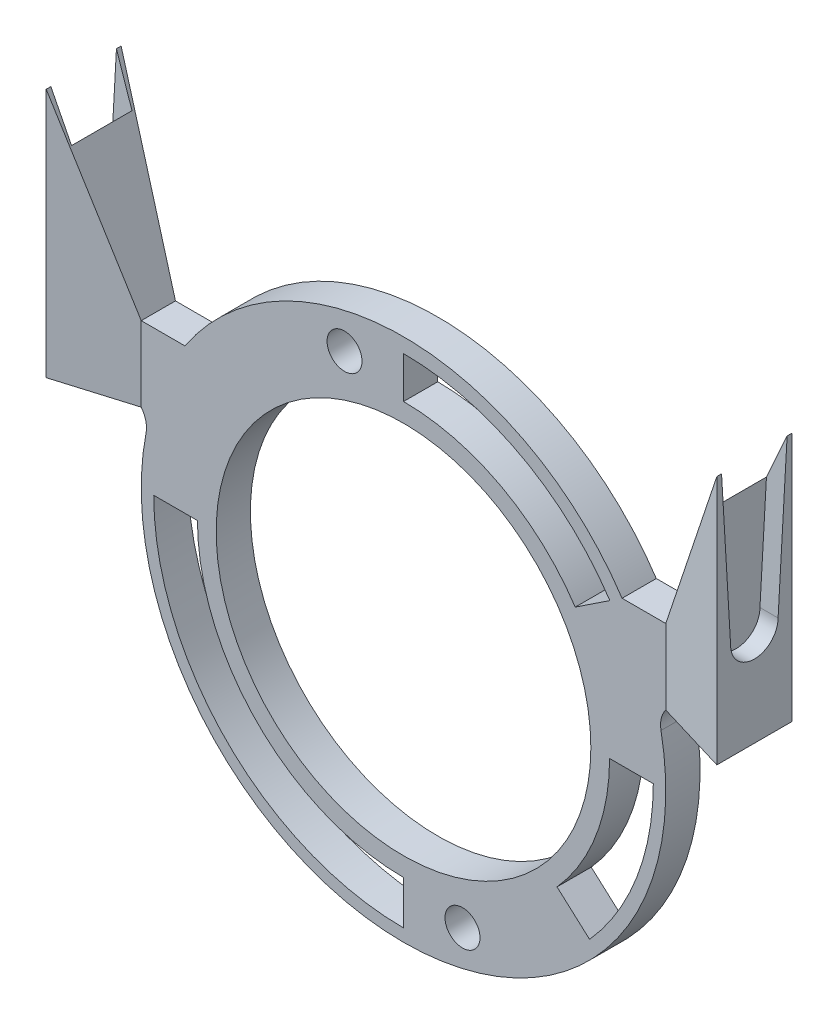
from build123d import *

# Parameters (mm, degrees)
SKETCH_1_R          = 15
SKETCH_1_R_2        = 1.4
EXTRUDE_1_DEPTH     = 2.74
SKETCH_3_W          = 2.74
SKETCH_3_H          = 6
EXTRUDE_3_DEPTH     = 3.5
SKETCH_11_W         = 2.74
SKETCH_11_H         = 6
EXTRUDE_8_DEPTH     = 3.5
FILLET_17_R         = 2
FILLET_19_R         = 2
CUT_EXTRUDE_1_DEPTH = 1.45
CUT_EXTRUDE_START   = -1.45
CUT_EXTRUDE_2_DEPTH = 1.45


with BuildPart() as part:
    # 草图1 → 凸台-拉伸1 (new body)
    with BuildSketch(Plane.XY):
        with BuildLine():
            Line((25.602982383, 9.901284161), (25.602982383, 3.901284161))
            Line((25.602982383, 3.901284161), (22.865684115, 3.901284161))
            ThreePointArc((22.865684115, 3.901284161), (43.102982383, -22.706902605), (63.340280651, 3.901284161))
            Line((63.340280651, 3.901284161), (60.602982383, 3.901284161))
            Line((60.602982383, 3.901284161), (60.602982383, 9.901284161))
            ThreePointArc((60.602982383, 9.901284161), (43.102982383, 19.293097395), (25.602982383, 9.901284161))
        make_face()
        with Locations((43.102982383, -1.706902605)):
            Circle(SKETCH_1_R, mode=Mode.SUBTRACT)
        with Locations((38.37953481, 15.921243725)):
            Circle(SKETCH_1_R_2, mode=Mode.SUBTRACT)
        with Locations((47.826429956, -19.335048935)):
            Circle(SKETCH_1_R_2, mode=Mode.SUBTRACT)
        with BuildLine():
            Line((26.602982383, -1.706902605), (23.102982383, -1.706902605))
            ThreePointArc((23.102982383, -1.706902605), (28.96084676, -15.849038229), (43.102982383, -21.706902605))
            Line((43.102982383, -21.706902605), (43.102982383, -18.206902605))
            ThreePointArc((43.102982383, -18.206902605), (31.435720494, -13.374164495), (26.602982383, -1.706902605))
        make_face(mode=Mode.SUBTRACT)
        with BuildLine():
            Line((43.102982383, 14.793097395), (43.102982383, 18.12026115))
            ThreePointArc((43.102982383, 18.12026115), (52.478832846, 15.763353566), (59.625618846, 9.252974534))
            Line((59.625618846, 9.252974534), (56.852982383, 7.413815568))
            ThreePointArc((56.852982383, 7.413815568), (50.905486793, 12.831698598), (43.102982383, 14.793097395))
        make_face(mode=Mode.SUBTRACT)
        with BuildLine():
            Line((55.393395475, -12.715796557), (58.000452797, -15.051016486))
            ThreePointArc((58.000452797, -15.051016486), (61.783847035, -8.850101879), (63.102982383, -1.706902605))
            Line((63.102982383, -1.706902605), (59.602982383, -1.706902605))
            ThreePointArc((59.602982383, -1.706902605), (58.514695721, -7.600042006), (55.393395475, -12.715796557))
        make_face(mode=Mode.SUBTRACT)
    extrude(amount=EXTRUDE_1_DEPTH)

    # 草图3 → 凸台-拉伸3 (add)
    with BuildSketch(Plane.ZY.offset(-25.602982383)):
        with Locations((1.37, 6.901284161)):
            Rectangle(SKETCH_3_W, SKETCH_3_H)
    extrude(amount=EXTRUDE_3_DEPTH)

    # 草图11 → 凸台-拉伸8 (add)
    with BuildSketch(Plane(origin=(60.602982383, 0, 0), x_dir=(0, 0, -1), z_dir=(1, 0, 0))):
        with Locations((-1.37, 6.901284161)):
            Rectangle(SKETCH_11_W, SKETCH_11_H)
    extrude(amount=EXTRUDE_8_DEPTH)

    # 圆角17
    # the kernel refuses this fillet: 2 mm, written as the material it adds along each edge
    with BuildSketch(Plane(origin=(63.340280651, 3.901284161, 0), x_dir=(0.228936975336042, -0.9734412469810308, 0), z_dir=(0, 0, 1))) as fillet_17_piece_1:
        with BuildLine():
            CenterArc((1.731032211, 1.998451636), FILLET_17_R, 218.902952144, 48.842355981)
            Line((0.174610628, 0.742445325), (0.143482196, 0.717325199))
            ThreePointArc((0.143482196, 0.717325199), (0.048367664, 0.380380141), (-0.03893765, 0.009157479))
            Line((-0.03893765, 0.009157479), (0.001573666, -0.039969033))
            ThreePointArc((0.001573666, -0.039969033), (0.826174465, -0.023742177), (1.650775263, -0.039969033))
            Line((1.650775263, -0.039969033), (1.652348929, 0))
        make_face()
    extrude(amount=2.74)

    # 圆角19
    # the kernel refuses this fillet: 2 mm, written as the material it adds along each edge
    with BuildSketch(Plane(origin=(22.865684115, 3.901284161, 0), x_dir=(-0.22893697533604487, -0.9734412469810302, 0), z_dir=(0, 0, 1))) as fillet_19_piece_1:
        with BuildLine():
            CenterArc((1.731032211, -1.998451636), FILLET_19_R, 92.254691875, 48.842355981)
            Line((0.174610628, -0.742445325), (0.143482196, -0.717325199))
            ThreePointArc((0.143482196, -0.717325199), (0.048367664, -0.380380141), (-0.03893765, -0.009157479))
            Line((-0.03893765, -0.009157479), (0.001573666, 0.039969033))
            ThreePointArc((0.001573666, 0.039969033), (0.826174465, 0.023742177), (1.650775263, 0.039969033))
            Line((1.650775263, 0.039969033), (1.652348929, 0))
        make_face()
    extrude(amount=2.74)

    # 放样2: read off the stored shape, not the designer's step
    # 放样2: loft between two sections, ruled curve by curve
    loft_2_from = [
        Edge.make_line((64.102982383, 3.901284161, 2.74), (64.102982383, 3.901284161, 0)),
        Edge.make_line((64.102982383, 9.901284161, 2.74), (64.102982383, 3.901284161, 2.74)),
        Edge.make_line((64.102982383, 3.901284161, 0), (64.102982383, 9.901284161, 0)),
        Edge.make_line((64.102982383, 9.901284161, 0), (64.102982383, 9.901284161, 2.74)),
    ]
    loft_2_to = [
        Edge.make_line((69.952982383, 3.901284161, 4.5), (69.952982383, 3.901284161, -1.5)),
        Edge.make_line((69.952982383, 23.901284161, 4.5), (69.952982383, 3.901284161, 4.5)),
        Edge.make_line((69.952982383, 3.901284161, -1.5), (69.952982383, 23.901284161, -1.5)),
        Edge.make_line((69.952982383, 23.901284161, -1.5), (69.952982383, 23.901284161, 4.5)),
    ]
    loft_2 = Solid(Shell([*[Face.make_surface_from_curves(loft_2_from[k], loft_2_to[k]) for k in range(4)], Face(Wire(loft_2_from)), Face(Wire(loft_2_to))]))
    add(loft_2)

    # 草图31 → 切除-拉伸1 (cut)
    with BuildSketch(Plane(origin=(69.952982383, 0, 0), x_dir=(0, 0, -1), z_dir=(1, 0, 0))):
        with BuildLine():
            Line((-1.5, 23.901284161), (-4.125, 23.901284161))
            Line((-4.125, 23.901284161), (-3.4, 11.641284161))
            ThreePointArc((-3.4, 11.641284161), (-1.5, 9.741284161), (0.4, 11.641284161))
            Line((0.4, 11.641284161), (1.125, 23.901284161))
            Line((1.125, 23.901284161), (-1.5, 23.901284161))
        make_face()
    extrude(amount=-CUT_EXTRUDE_1_DEPTH, mode=Mode.SUBTRACT)

    # 放样3: read off the stored shape, not the designer's step
    # 放样3: loft between two sections, ruled curve by curve
    loft_3_from = [
        Edge.make_line((22.102982383, 9.901284161, 0), (22.102982383, 3.901284161, 0)),
        Edge.make_line((22.102982383, 3.901284161, 2.74), (22.102982383, 9.901284161, 2.74)),
        Edge.make_line((22.102982383, 3.901284161, 2.74), (22.102982383, 3.901284161, 0)),
        Edge.make_line((22.102982383, 9.901284161, 2.74), (22.102982383, 9.901284161, 0)),
    ]
    loft_3_to = [
        Edge.make_line((16.252982383, 23.901284161, -1.5), (16.252982383, 3.901284161, -1.5)),
        Edge.make_line((16.252982383, 3.901284161, 4.5), (16.252982383, 23.901284161, 4.5)),
        Edge.make_line((16.252982383, 3.901284161, 4.5), (16.252982383, 3.901284161, -1.5)),
        Edge.make_line((16.252982383, 23.901284161, 4.5), (16.252982383, 23.901284161, -1.5)),
    ]
    loft_3 = Solid(Shell([*[Face.make_surface_from_curves(loft_3_from[k], loft_3_to[k]) for k in range(4)], Face(Wire(loft_3_from)), Face(Wire(loft_3_to))]))
    add(loft_3)

    # 草图32 → 切除-拉伸2 (cut)
    with BuildSketch(Plane.ZY.offset(-16.252982383).offset(CUT_EXTRUDE_START)):
        with BuildLine():
            Line((1.5, 23.901284161), (-1.125, 23.901284161))
            Line((-1.125, 23.901284161), (-0.4, 11.641284161))
            ThreePointArc((-0.4, 11.641284161), (1.5, 9.741284161), (3.4, 11.641284161))
            Line((3.4, 11.641284161), (4.125, 23.901284161))
            Line((4.125, 23.901284161), (1.5, 23.901284161))
        make_face()
    extrude(amount=CUT_EXTRUDE_2_DEPTH, mode=Mode.SUBTRACT)


solid = part.part
